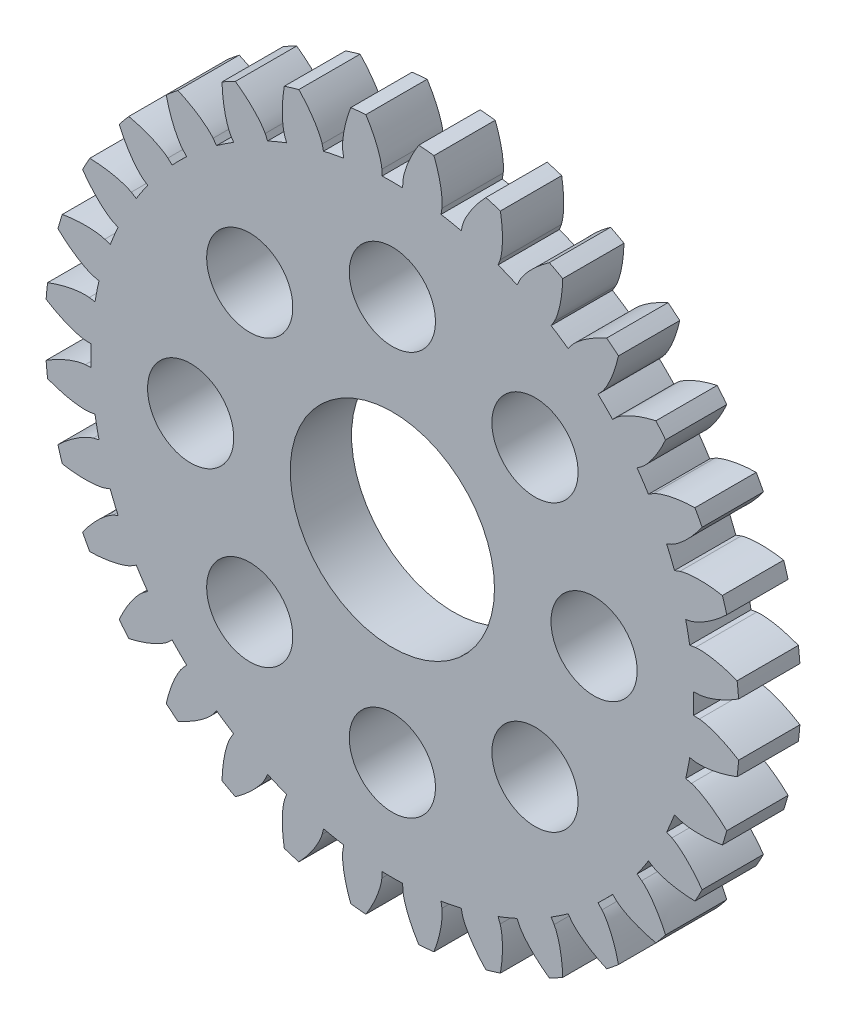
from build123d import *

# Parameters (mm, degrees)
EXTRUDE_1208_DEPTH          = 3
SKETCH_1293_R               = 49.569286557
SKETCH_1293_R_2             = 17
CUT_EXTRUDE_1634_DEPTH      = 53.206643128
CUT_EXTRUDE_2154_DEPTH      = 25.193386564
PATTERN_CIRCULAR_2257_COUNT = 32
SKETCH_2317_R               = 14.75
EXTRUDE_2640_DEPTH          = 3
SKETCH_3388_R               = 5
CUT_EXTRUDE_4039_DEPTH      = 25.158640266
SKETCH_2_R                  = 2.10975
CUT_EXTRUDE_1_DEPTH         = 25.158640266


with BuildPart() as part:
    # Sketch 1026 → Extrude 1208 (new body)
    with BuildSketch(Plane.XY):
        with BuildLine():
            Line((-46.692684482, -16.640534415), (0.513826997, -15.026299296))
            Line((0.513826997, -15.026299296), (0, 0))
            Line((0, 0), (0, 14.741383892))
            Line((0, 14.741383892), (-0.504084264, 14.741383892))
            Line((-0.504084264, 14.741383892), (-0.513826997, 15.026299296))
            add(Edge.make_bspline(
                [(-0.513826997, 15.026299296), (-0.515889075, 15.054831515), (-0.521761299, 15.111691225), (-0.540389964, 15.224595159), (-0.589193077, 15.436727695), (-0.675892203, 15.716023684), (-0.880469786, 16.231671151), (-1.297005307, 17.009555344), (-1.993063726, 17.973877136), (-3.148931724, 19.167799075), (-4.697413273, 20.348940478), (-6.567203448, 21.388631972), (-8.716985899, 22.219988579), (-10.951838774, 22.778990573), (-13.2347336, 23.082012745), (-15.649996156, 23.14779345), (-18.633230164, 22.91706654), (-22.131572555, 22.187568002), (-26.030647159, 20.755253581), (-30.063654135, 18.514112374), (-33.730827443, 15.7177416), (-36.579001564, 12.861318251), (-38.742827552, 10.170685138), (-40.354672748, 7.790343292), (-41.527356695, 5.81198096), (-42.845474061, 3.25754218), (-43.965005175, 0.607443805), (-44.884776855, -2.117401303), (-45.749527291, -5.457144906), (-46.219817569, -8.001288168), (-46.500586979, -10.286314126), (-46.645085237, -12.289435146), (-46.691895914, -13.300248232), (-46.714786397, -14.149099809), (-46.721252034, -14.931849349), (-46.72042047, -15.537746326), (-46.708127253, -16.132545418), (-46.698424184, -16.472683207), (-46.692684482, -16.640534415)],
                knots=[0, 0, 0, 0, 0, 0.001401017, 0.002802034, 0.005604068, 0.010661158, 0.015718248, 0.029959916, 0.048733667, 0.068727063, 0.096888892, 0.125050566, 0.153212235, 0.18137365, 0.209534907, 0.23769631, 0.271429412, 0.327752301, 0.384075274, 0.440398193, 0.496721184, 0.553044153, 0.581205638, 0.609367123, 0.637528617, 0.665690111, 0.72201302, 0.750174495, 0.77833597, 0.834658858, 0.848739645, 0.862820432, 0.876901219, 0.883941612, 0.890982006, 0.90003647, 0.909090935, 0.909090935, 0.909090935, 0.909090935, 0.909090935], degree=4))
        make_face()
    extrude(amount=EXTRUDE_1208_DEPTH)

    # Mirror 1254: part across plane


with BuildPart() as part_1:
    add(part.part)
    add(part.part.mirror(Plane(origin=(0, 0, 3), x_dir=(0, 0, 1), z_dir=(1, 0, 0))))

    # Sketch 1293 → Cut-Extrude 1634 (cut, through all)
    with BuildSketch(Plane.XY.offset(3)):
        Circle(SKETCH_1293_R)
        Circle(SKETCH_1293_R_2, mode=Mode.SUBTRACT)
    extrude(amount=-CUT_EXTRUDE_1634_DEPTH, mode=Mode.SUBTRACT)

    # Sketch 1794 → Cut-Extrude 2154 (cut, through all)
    with BuildSketch(Plane.XY.offset(3)):
        with BuildLine():
            Line((-1.666291386, 16.918140353), (0, 0))
            Line((0, 0), (1.666291386, 16.918140353))
            ThreePointArc((1.666291386, 16.918140353), (0, -17), (-1.666291386, 16.918140353))
        make_face()
    extrude(amount=-CUT_EXTRUDE_2154_DEPTH, mode=Mode.SUBTRACT)


with BuildPart() as pattern_circular_2257_1:
    # Pattern Circular 2257: pattern copy
    add(part_1.part.rotate(Axis((0, 0, 0), (0, 0, 1)), 1 * 360 / PATTERN_CIRCULAR_2257_COUNT))


with BuildPart() as pattern_circular_2257_2:
    # Pattern Circular 2257: pattern copy
    add(part_1.part.rotate(Axis((0, 0, 0), (0, 0, 1)), 2 * 360 / PATTERN_CIRCULAR_2257_COUNT))


with BuildPart() as pattern_circular_2257_3:
    # Pattern Circular 2257: pattern copy
    add(part_1.part.rotate(Axis((0, 0, 0), (0, 0, 1)), 3 * 360 / PATTERN_CIRCULAR_2257_COUNT))


with BuildPart() as pattern_circular_2257_4:
    # Pattern Circular 2257: pattern copy
    add(part_1.part.rotate(Axis((0, 0, 0), (0, 0, 1)), 4 * 360 / PATTERN_CIRCULAR_2257_COUNT))


with BuildPart() as pattern_circular_2257_5:
    # Pattern Circular 2257: pattern copy
    add(part_1.part.rotate(Axis((0, 0, 0), (0, 0, 1)), 5 * 360 / PATTERN_CIRCULAR_2257_COUNT))


with BuildPart() as pattern_circular_2257_6:
    # Pattern Circular 2257: pattern copy
    add(part_1.part.rotate(Axis((0, 0, 0), (0, 0, 1)), 6 * 360 / PATTERN_CIRCULAR_2257_COUNT))


with BuildPart() as pattern_circular_2257_7:
    # Pattern Circular 2257: pattern copy
    add(part_1.part.rotate(Axis((0, 0, 0), (0, 0, 1)), 7 * 360 / PATTERN_CIRCULAR_2257_COUNT))


with BuildPart() as pattern_circular_2257_8:
    # Pattern Circular 2257: pattern copy
    add(part_1.part.rotate(Axis((0, 0, 0), (0, 0, 1)), 8 * 360 / PATTERN_CIRCULAR_2257_COUNT))


with BuildPart() as pattern_circular_2257_9:
    # Pattern Circular 2257: pattern copy
    add(part_1.part.rotate(Axis((0, 0, 0), (0, 0, 1)), 9 * 360 / PATTERN_CIRCULAR_2257_COUNT))


with BuildPart() as pattern_circular_2257_10:
    # Pattern Circular 2257: pattern copy
    add(part_1.part.rotate(Axis((0, 0, 0), (0, 0, 1)), 10 * 360 / PATTERN_CIRCULAR_2257_COUNT))


with BuildPart() as pattern_circular_2257_11:
    # Pattern Circular 2257: pattern copy
    add(part_1.part.rotate(Axis((0, 0, 0), (0, 0, 1)), 11 * 360 / PATTERN_CIRCULAR_2257_COUNT))


with BuildPart() as pattern_circular_2257_12:
    # Pattern Circular 2257: pattern copy
    add(part_1.part.rotate(Axis((0, 0, 0), (0, 0, 1)), 12 * 360 / PATTERN_CIRCULAR_2257_COUNT))


with BuildPart() as pattern_circular_2257_13:
    # Pattern Circular 2257: pattern copy
    add(part_1.part.rotate(Axis((0, 0, 0), (0, 0, 1)), 13 * 360 / PATTERN_CIRCULAR_2257_COUNT))


with BuildPart() as pattern_circular_2257_14:
    # Pattern Circular 2257: pattern copy
    add(part_1.part.rotate(Axis((0, 0, 0), (0, 0, 1)), 14 * 360 / PATTERN_CIRCULAR_2257_COUNT))


with BuildPart() as pattern_circular_2257_15:
    # Pattern Circular 2257: pattern copy
    add(part_1.part.rotate(Axis((0, 0, 0), (0, 0, 1)), 15 * 360 / PATTERN_CIRCULAR_2257_COUNT))


with BuildPart() as pattern_circular_2257_16:
    # Pattern Circular 2257: pattern copy
    add(part_1.part.rotate(Axis((0, 0, 0), (0, 0, 1)), 16 * 360 / PATTERN_CIRCULAR_2257_COUNT))


with BuildPart() as pattern_circular_2257_17:
    # Pattern Circular 2257: pattern copy
    add(part_1.part.rotate(Axis((0, 0, 0), (0, 0, 1)), 17 * 360 / PATTERN_CIRCULAR_2257_COUNT))


with BuildPart() as pattern_circular_2257_18:
    # Pattern Circular 2257: pattern copy
    add(part_1.part.rotate(Axis((0, 0, 0), (0, 0, 1)), 18 * 360 / PATTERN_CIRCULAR_2257_COUNT))


with BuildPart() as pattern_circular_2257_19:
    # Pattern Circular 2257: pattern copy
    add(part_1.part.rotate(Axis((0, 0, 0), (0, 0, 1)), 19 * 360 / PATTERN_CIRCULAR_2257_COUNT))


with BuildPart() as pattern_circular_2257_20:
    # Pattern Circular 2257: pattern copy
    add(part_1.part.rotate(Axis((0, 0, 0), (0, 0, 1)), 20 * 360 / PATTERN_CIRCULAR_2257_COUNT))


with BuildPart() as pattern_circular_2257_21:
    # Pattern Circular 2257: pattern copy
    add(part_1.part.rotate(Axis((0, 0, 0), (0, 0, 1)), 21 * 360 / PATTERN_CIRCULAR_2257_COUNT))


with BuildPart() as pattern_circular_2257_22:
    # Pattern Circular 2257: pattern copy
    add(part_1.part.rotate(Axis((0, 0, 0), (0, 0, 1)), 22 * 360 / PATTERN_CIRCULAR_2257_COUNT))


with BuildPart() as pattern_circular_2257_23:
    # Pattern Circular 2257: pattern copy
    add(part_1.part.rotate(Axis((0, 0, 0), (0, 0, 1)), 23 * 360 / PATTERN_CIRCULAR_2257_COUNT))


with BuildPart() as pattern_circular_2257_24:
    # Pattern Circular 2257: pattern copy
    add(part_1.part.rotate(Axis((0, 0, 0), (0, 0, 1)), 24 * 360 / PATTERN_CIRCULAR_2257_COUNT))


with BuildPart() as pattern_circular_2257_25:
    # Pattern Circular 2257: pattern copy
    add(part_1.part.rotate(Axis((0, 0, 0), (0, 0, 1)), 25 * 360 / PATTERN_CIRCULAR_2257_COUNT))


with BuildPart() as pattern_circular_2257_26:
    # Pattern Circular 2257: pattern copy
    add(part_1.part.rotate(Axis((0, 0, 0), (0, 0, 1)), 26 * 360 / PATTERN_CIRCULAR_2257_COUNT))


with BuildPart() as pattern_circular_2257_27:
    # Pattern Circular 2257: pattern copy
    add(part_1.part.rotate(Axis((0, 0, 0), (0, 0, 1)), 27 * 360 / PATTERN_CIRCULAR_2257_COUNT))


with BuildPart() as pattern_circular_2257_28:
    # Pattern Circular 2257: pattern copy
    add(part_1.part.rotate(Axis((0, 0, 0), (0, 0, 1)), 28 * 360 / PATTERN_CIRCULAR_2257_COUNT))


with BuildPart() as pattern_circular_2257_29:
    # Pattern Circular 2257: pattern copy
    add(part_1.part.rotate(Axis((0, 0, 0), (0, 0, 1)), 29 * 360 / PATTERN_CIRCULAR_2257_COUNT))


with BuildPart() as pattern_circular_2257_30:
    # Pattern Circular 2257: pattern copy
    add(part_1.part.rotate(Axis((0, 0, 0), (0, 0, 1)), 30 * 360 / PATTERN_CIRCULAR_2257_COUNT))


with BuildPart() as pattern_circular_2257_31:
    # Pattern Circular 2257: pattern copy
    add(part_1.part.rotate(Axis((0, 0, 0), (0, 0, 1)), 31 * 360 / PATTERN_CIRCULAR_2257_COUNT))


with BuildPart() as part_2:
    add(part_1.part)

    add(pattern_circular_2257_1.part)  # Extrude 2640 merges Pattern Circular 2257_1

    add(pattern_circular_2257_2.part)  # Extrude 2640 merges Pattern Circular 2257_2

    add(pattern_circular_2257_3.part)  # Extrude 2640 merges Pattern Circular 2257_3

    add(pattern_circular_2257_4.part)  # Extrude 2640 merges Pattern Circular 2257_4

    add(pattern_circular_2257_5.part)  # Extrude 2640 merges Pattern Circular 2257_5

    add(pattern_circular_2257_6.part)  # Extrude 2640 merges Pattern Circular 2257_6

    add(pattern_circular_2257_7.part)  # Extrude 2640 merges Pattern Circular 2257_7

    add(pattern_circular_2257_8.part)  # Extrude 2640 merges Pattern Circular 2257_8

    add(pattern_circular_2257_9.part)  # Extrude 2640 merges Pattern Circular 2257_9

    add(pattern_circular_2257_10.part)  # Extrude 2640 merges Pattern Circular 2257_10

    add(pattern_circular_2257_11.part)  # Extrude 2640 merges Pattern Circular 2257_11

    add(pattern_circular_2257_12.part)  # Extrude 2640 merges Pattern Circular 2257_12

    add(pattern_circular_2257_13.part)  # Extrude 2640 merges Pattern Circular 2257_13

    add(pattern_circular_2257_14.part)  # Extrude 2640 merges Pattern Circular 2257_14

    add(pattern_circular_2257_15.part)  # Extrude 2640 merges Pattern Circular 2257_15

    add(pattern_circular_2257_16.part)  # Extrude 2640 merges Pattern Circular 2257_16

    add(pattern_circular_2257_17.part)  # Extrude 2640 merges Pattern Circular 2257_17

    add(pattern_circular_2257_18.part)  # Extrude 2640 merges Pattern Circular 2257_18

    add(pattern_circular_2257_19.part)  # Extrude 2640 merges Pattern Circular 2257_19

    add(pattern_circular_2257_20.part)  # Extrude 2640 merges Pattern Circular 2257_20

    add(pattern_circular_2257_21.part)  # Extrude 2640 merges Pattern Circular 2257_21

    add(pattern_circular_2257_22.part)  # Extrude 2640 merges Pattern Circular 2257_22

    add(pattern_circular_2257_23.part)  # Extrude 2640 merges Pattern Circular 2257_23

    add(pattern_circular_2257_24.part)  # Extrude 2640 merges Pattern Circular 2257_24

    add(pattern_circular_2257_25.part)  # Extrude 2640 merges Pattern Circular 2257_25

    add(pattern_circular_2257_26.part)  # Extrude 2640 merges Pattern Circular 2257_26

    add(pattern_circular_2257_27.part)  # Extrude 2640 merges Pattern Circular 2257_27

    add(pattern_circular_2257_28.part)  # Extrude 2640 merges Pattern Circular 2257_28

    add(pattern_circular_2257_29.part)  # Extrude 2640 merges Pattern Circular 2257_29

    add(pattern_circular_2257_30.part)  # Extrude 2640 merges Pattern Circular 2257_30

    add(pattern_circular_2257_31.part)  # Extrude 2640 merges Pattern Circular 2257_31
    # Sketch 2317 → Extrude 2640 (add, through all)
    with BuildSketch(Plane.XY.offset(3)):
        Circle(SKETCH_2317_R)
    extrude(amount=-EXTRUDE_2640_DEPTH)

    # Sketch 3388 → Cut-Extrude 4039 (cut, through all)
    with BuildSketch(Plane.XY.offset(3)):
        Circle(SKETCH_3388_R)
    extrude(amount=-CUT_EXTRUDE_4039_DEPTH, mode=Mode.SUBTRACT)

    # ｽｹｯﾁ2 → ｶｯﾄ - 押し出し1 (cut, through all)
    with BuildSketch(Plane(origin=(0, 0, 0), x_dir=(-1, 0, 0), z_dir=(0, 0, -1))):
        with Locations((0, -9.875)):
            Circle(SKETCH_2_R)
        with Locations((-6.982679464, -6.982679464)):
            Circle(SKETCH_2_R)
        with Locations((-9.875, 0)):
            Circle(SKETCH_2_R)
        with Locations((-6.982679464, 6.982679464)):
            Circle(SKETCH_2_R)
        with Locations((0, 9.875)):
            Circle(SKETCH_2_R)
        with Locations((6.982679464, 6.982679464)):
            Circle(SKETCH_2_R)
        with Locations((9.875, 0)):
            Circle(SKETCH_2_R)
        with Locations((6.982679464, -6.982679464)):
            Circle(SKETCH_2_R)
    extrude(amount=-CUT_EXTRUDE_1_DEPTH, mode=Mode.SUBTRACT)


solid = part_2.part
